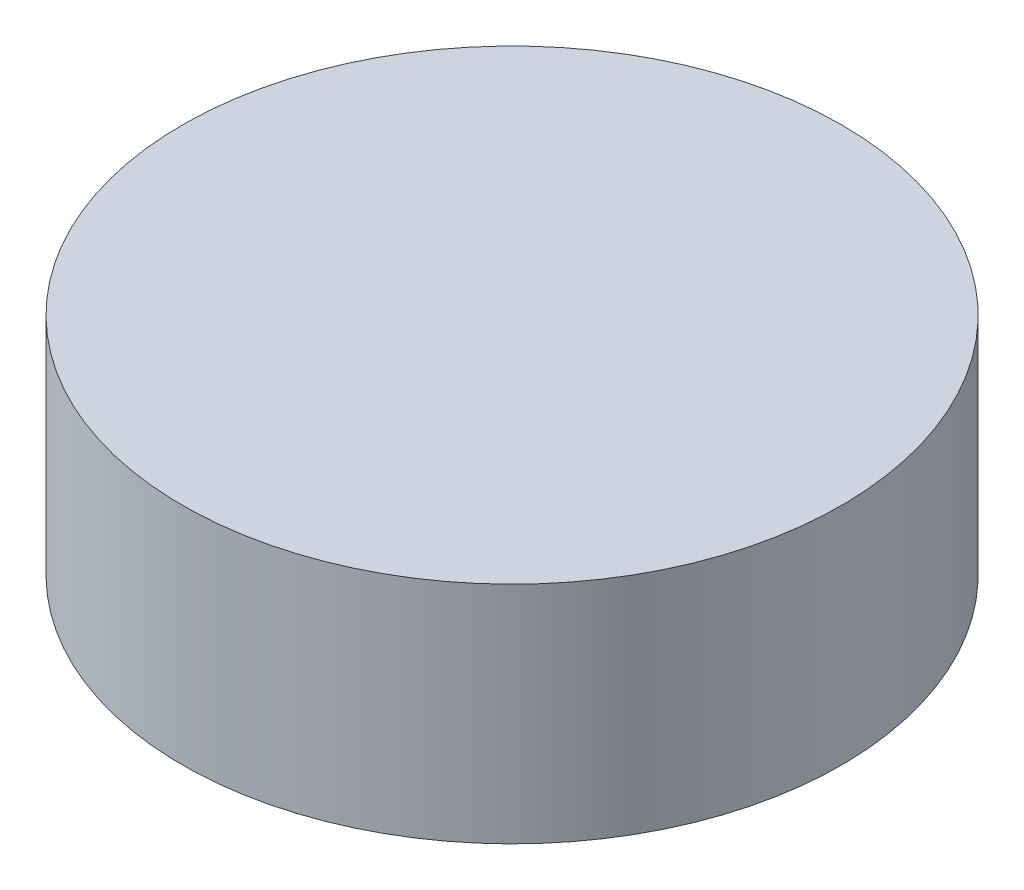
from build123d import *

# Parameters (mm, degrees)
SKETCH3_R           = 19.05
BOSS_EXTRUDE1_DEPTH = 13
SKETCH6_R           = 10.126999939
CUT_EXTRUDE2_DEPTH  = 8


with BuildPart() as part:
    # Sketch3 → Boss-Extrude1 (new body)
    with BuildSketch(Plane(origin=(0, 0, 0), x_dir=(1, 0, 0), z_dir=(0, 1, 0))):
        Circle(SKETCH3_R)
    extrude(amount=BOSS_EXTRUDE1_DEPTH)

    # Sketch6 → Cut-Extrude2 (cut)
    with BuildSketch(Plane.XZ):
        Circle(SKETCH6_R)
    extrude(amount=-CUT_EXTRUDE2_DEPTH, mode=Mode.SUBTRACT)


solid = part.part
